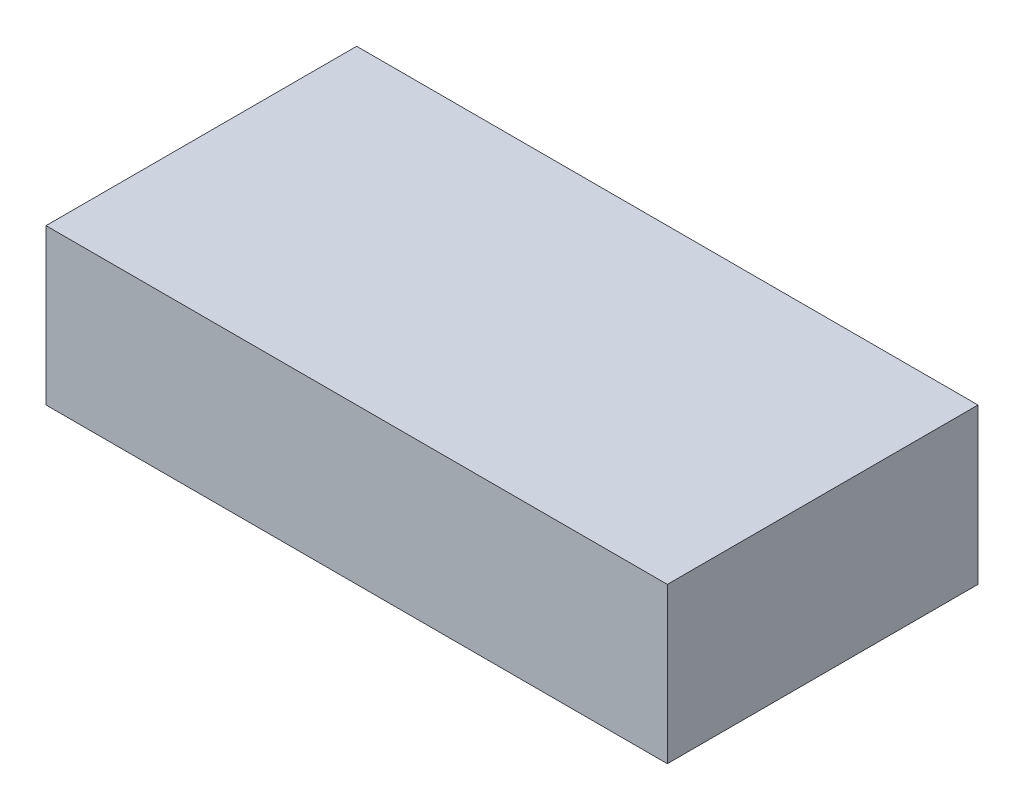
from build123d import *

# Parameters (mm, degrees)
SKETCH1_W           = 40
SKETCH1_H           = 20
BOSS_EXTRUDE1_DEPTH = 10


with BuildPart() as part:
    # Sketch1 → Boss-Extrude1 (new body)
    with BuildSketch(Plane(origin=(0, 0, 0), x_dir=(1, 0, 0), z_dir=(0, 1, 0))):
        with Locations((20, 10)):
            Rectangle(SKETCH1_W, SKETCH1_H)
    extrude(amount=BOSS_EXTRUDE1_DEPTH)


solid = part.part
